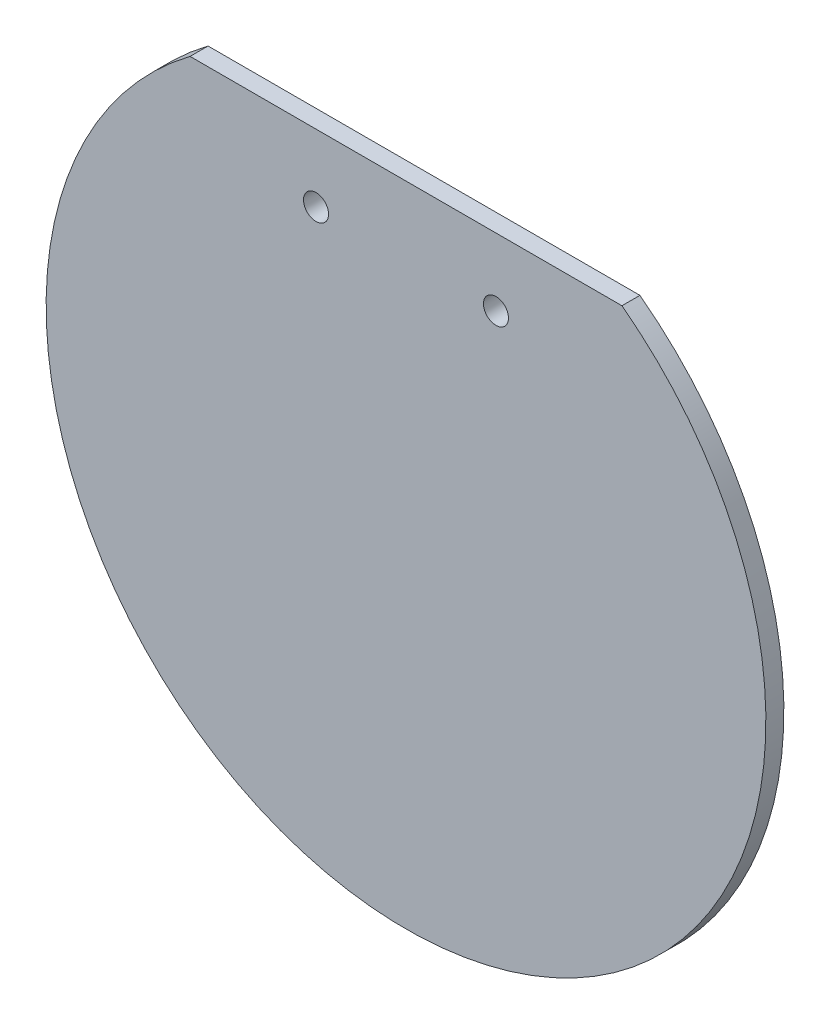
from build123d import *

# Parameters (mm, degrees)
BOSS_EXTRUDE1_DEPTH = 1.5875
SKETCH3_R           = 1.1049
CUT_EXTRUDE1_DEPTH  = 45.929335141


with BuildPart() as part:
    # Sketch1 → Boss-Extrude1 (new body)
    with BuildSketch(Plane.XY):
        with BuildLine():
            Line((-19.05, 25.4), (19.05, 25.4))
            ThreePointArc((19.05, 25.4), (0, -31.75), (-19.05, 25.4))
        make_face()
    extrude(amount=BOSS_EXTRUDE1_DEPTH)

    # Sketch3 → Cut-Extrude1 (cut, through all)
    with BuildSketch(Plane.XY.offset(1.5875)):
        with Locations((7.9375, 19.44624)):
            Circle(SKETCH3_R)
        with Locations((-7.9375, 19.44624)):
            Circle(SKETCH3_R)
    extrude(amount=-CUT_EXTRUDE1_DEPTH, mode=Mode.SUBTRACT)


solid = part.part
